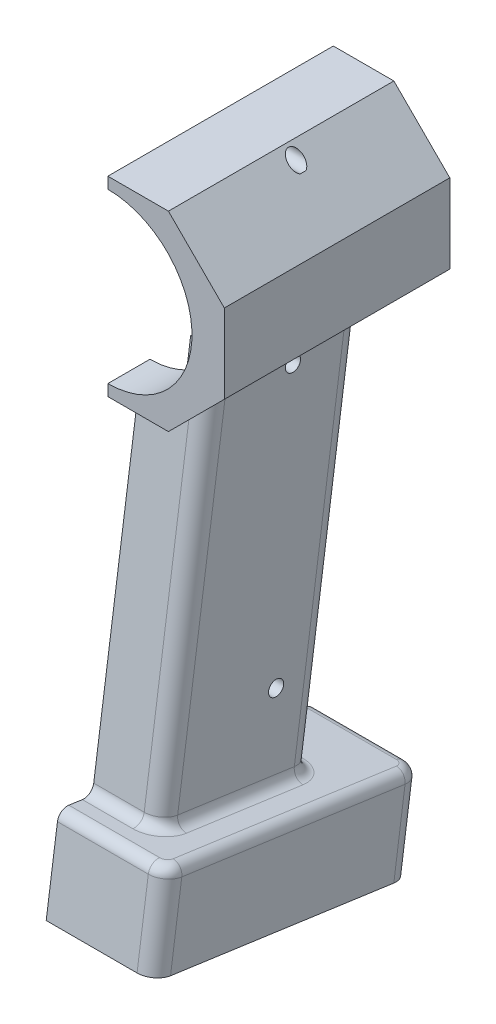
from build123d import *
from build123d.topology import SkipClean

# Parameters (mm, degrees)
Y_KSEKLIK_EKSTR_ZYON1_DEPTH      = 67
IZIM2_R                          = 25.000000000000004
KES_EKSTR_ZYON1_DEPTH            = 70
Y_KSEKLIK_EKSTR_ZYON2_DEPTH      = 40
Y_KSEKLIK_EKSTR_ZYON7_DEPTH      = 100
Y_KSEKLIK_EKSTR_ZYON7_DEPTH_BACK = 15
IZIM11_R                         = 22.5
KES_EKSTR_ZYON17_DEPTH           = 33
KES_EKSTR_ZYON18_DEPTH           = 20
Y_KSEKLIK_EKSTR_ZYON12_DEPTH     = 8
Y_KSEKLIK_EKSTR_ZYON14_DEPTH     = 15
KES_EKSTR_ZYON20_DEPTH           = 3
IZIM44_R                         = 22.600000000000005
KES_EKSTR_ZYON25_DEPTH           = 30
RADYUS4_R                        = 5
RADYUS5_START                    = -109.324597764
RADYUS5_DEPTH                    = 115
Y_KSEKLIK_EKSTR_ZYON27_DEPTH     = 27
Y_KSEKLIK_EKSTR_ZYON29_START     = 5
Y_KSEKLIK_EKSTR_ZYON29_DEPTH     = 5
RADYUS6_R                        = 3
RADYUS7_R                        = 5
IZIM53_R                         = 1.0999999999999992
IZIM53_R_2                       = 1.0999999999999983
KES_EKSTR_ZYON28_DEPTH           = 3
IZIM54_R                         = 4.249999999999999
IZIM54_R_2                       = 3.099999999999997
Y_KSEKLIK_EKSTR_ZYON33_DEPTH     = 22.5
Y_KSEKLIK_EKSTR_ZYON34_DEPTH     = 67
RADYUS9_R                        = 3
IZIM63_R                         = 0.8999999999999964
IZIM63_R_2                       = 0.8999999999999968
KES_EKSTR_ZYON30_DEPTH           = 6
RADYUS10_R                       = 3
KES_EKSTR_ZYON31_START           = -10
IZIM64_R                         = 3.099999999999997
KES_EKSTR_ZYON31_DEPTH           = 10
IZIM65_R                         = 2.2499999999999996
IZIM65_R_2                       = 2.249999999999999
KES_EKSTR_ZYON32_DEPTH           = 20
IZIM68_R                         = 3.099999999999997
Y_KSEKLIK_EKSTR_ZYON35_DEPTH     = 5
IZIM69_R                         = 1.1000000000000003
KES_EKSTR_ZYON35_DEPTH           = 3
IZIM70_R                         = 2.2500000000000027
KES_EKSTR_ZYON36_DEPTH           = 3
Y_KSEKLIK_EKSTR_ZYON36_START     = 15
IZIM71_R                         = 3.099999999999997
IZIM71_R_2                       = 2.2500000000000027
Y_KSEKLIK_EKSTR_ZYON36_DEPTH     = 15
IZIM72_R                         = 25.000000000000004
KES_EKSTR_ZYON37_DEPTH           = 30


with BuildPart() as part:
    # Çizim1 → Yükseklik-Ekstrüzyon1 (new body)
    with BuildSketch(Plane.XY):
        Polygon((0, 0), (-18, -2.2e-15), (-34.617009357884086, 16.617009357883635), (-34.617009357884086, 40.117009357883624), (-18.000000000000455, 56.73401871576772), (-4.545e-13, 56.73401871576772), align=None)
    extrude(amount=Y_KSEKLIK_EKSTR_ZYON1_DEPTH)

    # Çizim2 → Kes-Ekstrüzyon1 (cut)
    with BuildSketch(Plane.XY.offset(67)):
        with Locations((0, 28.367009357883862)):
            Circle(IZIM2_R)
    extrude(amount=-KES_EKSTR_ZYON1_DEPTH, mode=Mode.SUBTRACT)

    # Çizim5 → Yükseklik-Ekstrüzyon2 (add)
    with BuildSketch(Plane.XY.offset(37.00000000000001)):
        with BuildLine():
            Line((0, 50.96700935788387), (-4.2591e-13, 53.367009357883866))
            ThreePointArc((-4.2591e-13, 53.36700935788386), (-25, 28.367009357883667), (-3.412e-14, 3.3670093578838625))
            Line((-2.697e-14, 3.367009357883862), (0, 5.767009357883861))
            ThreePointArc((-4.15e-15, 5.767009357883861), (-22.6, 28.367009357883866), (1.38e-15, 50.96700935788387))
        make_face()
    extrude(amount=-Y_KSEKLIK_EKSTR_ZYON2_DEPTH)

    # Çizim24 → Kes-Ekstrüzyon18 (cut)
    with BuildSketch(Plane(origin=(0, -9.233851419869488, 1.2977331860663228), x_dir=(0, -0.13917310096006572, -0.9902680687415703), z_dir=(0, -0.9902680687415703, 0.13917310096006572))):
        Polygon((-54.45315730366845, 3.1e-16), (-42.45315730366844, 0), (-42.45315730366844, -17), (-54.45315730366845, -17), align=None)
    extrude(amount=-KES_EKSTR_ZYON18_DEPTH, mode=Mode.SUBTRACT)



with BuildPart() as body_2:
    # Çizim21 → Yükseklik-Ekstrüzyon7 (new, two sides: drawn at the far end of the back side and taken through both)
    with BuildSketch(Plane(origin=(0, -9.233851419869488, 1.2977331860663228), x_dir=(0, -0.13917310096006572, -0.9902680687415703), z_dir=(0, -0.9902680687415703, 0.13917310096006572)).offset(-Y_KSEKLIK_EKSTR_ZYON7_DEPTH_BACK)):
        Polygon((-56.95315730366845, 0), (-56.95315730366844, -20), (-11.95315730366845, -19.999999999999993), (-11.953157303668451, 8.27e-15), (-14.453157303668451, 7.96e-15), (-14.45315730366845, -17.499999999999996), (-54.45315730366845, -17.499999999999996), (-54.45315730366845, 3.1e-16), align=None)
    extrude(amount=Y_KSEKLIK_EKSTR_ZYON7_DEPTH + Y_KSEKLIK_EKSTR_ZYON7_DEPTH_BACK)

    # Çizim11 → Kes-Ekstrüzyon17 (cut)
    with BuildSketch(Plane.XY.offset(37.00000000000001)):
        with Locations((0, 28.367009357883862)):
            Circle(IZIM11_R)
    extrude(amount=-KES_EKSTR_ZYON17_DEPTH, mode=Mode.SUBTRACT)


with BuildPart() as part_1:
    add(part.part)

    add(body_2.part)  # Yükseklik-Ekstrüzyon12 merges body 2
    # Çizim29 → Yükseklik-Ekstrüzyon12 (add)
    with BuildSketch(Plane(origin=(0, -9.233851419869488, 1.2977331860663228), x_dir=(0, -0.13917310096006572, -0.9902680687415703), z_dir=(0, -0.9902680687415703, 0.13917310096006572))):
        Polygon((-42.45315730366844, 0), (-14.453157303668446, 0), (-14.453157303668442, -17.499999999999996), (-42.45315730366844, -17.499999999999996), align=None)
    extrude(amount=-Y_KSEKLIK_EKSTR_ZYON12_DEPTH)

    # Çizim31 → Yükseklik-Ekstrüzyon14 (add)
    with BuildSketch(Plane(origin=(0, -9.233851419869485, 1.2977331860663224), x_dir=(1, 0, 0), z_dir=(0, -0.9902680687415703, 0.13917310096006574))):
        Polygon((9.7e-16, 19.053157303668446), (2.4e-16, 17.053157303668446), (-4.9, 17.053157303668442), (-4.9, 14.45315730366844), (-17.499999999999996, 14.45315730366844), (-17.499999999999996, 19.053157303668446), align=None)
    extrude(amount=Y_KSEKLIK_EKSTR_ZYON14_DEPTH)

    # Çizim34 → Kes-Ekstrüzyon20 (cut)
    with BuildSketch(Plane(origin=(-1.1e-15, 1.663557968214996, 11.83682999846795), x_dir=(-1, -1e-17, -9e-17), z_dir=(0, -0.13917310096006574, -0.9902680687415703))):
        Polygon((-1.17e-15, -20.024597764324398), (3.0999999999999988, -20.024597764324398), (3.0999999999999983, -13.824597764324396), (-1.17e-15, -13.824597764324396), align=None)
    extrude(amount=-KES_EKSTR_ZYON20_DEPTH, mode=Mode.SUBTRACT)

    # Çizim44 → Kes-Ekstrüzyon25 (cut)
    with SkipClean():  # the faces are left unmerged after this step: merging them gives an invalid solid
        with BuildSketch(Plane.XY.offset(37.00000000000001)):
            with Locations((0, 28.367009357883862)):
                Circle(IZIM44_R)
        extrude(amount=-KES_EKSTR_ZYON25_DEPTH, mode=Mode.SUBTRACT)

    # Radyus4
    radyus4_edges = [part_1.edges().sort_by_distance(p)[0] for p in [
        (-19.999999999999993, -52.29855016290579, 19.420709717516388),
        (-20, -49.167155391304306, 64.42286164587061),
    ]]
    fillet(radyus4_edges, radius=RADYUS4_R)

    # Radyus5: read off the stored shape, not the designer's step
    # Radyus5 outline → Radyus5 (add)
    with SkipClean():  # the faces are left unmerged after this step: merging them gives an invalid solid
        with BuildSketch(Plane(origin=(0, 0, 0), x_dir=(1, 0, 0), z_dir=(0, 0.9902680687415703, -0.13917310096006602)).offset(RADYUS5_START)):
            with BuildLine():
                Line((-17.5, -52.453157304), (-17.5, -54.453157304))
                Line((-17.5, -54.453157304), (-15.5, -54.453157304))
                ThreePointArc((-15.5, -54.453157304), (-16.914213562, -53.867370866), (-17.5, -52.453157304))
            make_face()
            with BuildLine():
                Line((-17.5, -14.453157304), (-17.5, -16.453157304))
                ThreePointArc((-17.5, -16.453157304), (-16.914213562, -15.038943742), (-15.5, -14.453157304))
                Line((-15.5, -14.453157304), (-17.5, -14.453157304))
            make_face()
        extrude(amount=RADYUS5_DEPTH)



with BuildPart() as body_2_2:
    # Çizim45 → Yükseklik-Ekstrüzyon27 (new body)
    with BuildSketch(Plane(origin=(0, -108.26065829402661, 15.215043282072942), x_dir=(1, 0, 0), z_dir=(0, -0.9902680687415704, 0.13917310096006608))):
        Polygon((0, 67), (-32, 67), (-32, -10), (1.22e-15, -10), (0, -4.999999999999998), (-26.999999999999996, -4.999999999999998), (-27, 62), (6.1e-16, 62.00000000000001), align=None)
    extrude(amount=Y_KSEKLIK_EKSTR_ZYON27_DEPTH)


with BuildPart() as part_2:
    with SkipClean():  # the faces are left unmerged after this step: merging them gives an invalid solid
        add(part_1.part)

        add(body_2_2.part)  # Yükseklik-Ekstrüzyon29 merges body 2 2
        # Çizim58 → Yükseklik-Ekstrüzyon29 (add)
        with BuildSketch(Plane(origin=(0, -108.26065829402661, 15.215043282072942), x_dir=(1, 0, 0), z_dir=(0, -0.9902680687415704, 0.13917310096006608)).offset(Y_KSEKLIK_EKSTR_ZYON29_START)):
            with BuildLine():
                Line((-15.000000000000002, 56.95315730366841), (0, 56.95315730366841))
                Line((4.1e-16, 56.95315730366841), (6.1e-16, 62.00000000000003))
                Line((0, 62.00000000000003), (-27, 62.000000000000014))
                Line((-27, 62.000000000000014), (-26.999999999999996, -4.999999999999997))
                Line((-26.999999999999996, -4.999999999999997), (0, -4.999999999999997))
                Line((0, -4.999999999999998), (6.94e-15, 11.953157303668416))
                Line((8.88e-15, 11.953157303668416), (-14.999999999999993, 11.953157303668416))
                ThreePointArc((-14.999999999999993, 11.953157303668416), (-18.53553390593273, 13.417623397735682), (-19.999999999999993, 16.953157303668416))
                Line((-19.999999999999993, 16.953157303668412), (-20, 51.95315730366841))
                ThreePointArc((-20, 51.95315730366841), (-18.535533905932738, 55.48869120960115), (-15.000000000000002, 56.95315730366841))
            make_face()
            with BuildLine():
                ThreePointArc((-17.499999999999996, 52.453157303668426), (-16.91421356237308, 53.86737086604151), (-15.499999999999995, 54.45315730366841))
                Line((-15.499999999999995, 54.45315730366841), (0, 54.45315730366841))
                Line((3.1e-16, 54.45315730366841), (4.1e-16, 56.95315730366841))
                Line((0, 56.95315730366841), (-15.000000000000002, 56.95315730366841))
                ThreePointArc((-15.000000000000002, 56.95315730366841), (-18.535533905932738, 55.48869120960115), (-20, 51.95315730366841))
                Line((-20, 51.95315730366841), (-19.999999999999993, 16.953157303668412))
                ThreePointArc((-19.999999999999993, 16.953157303668416), (-18.53553390593273, 13.417623397735682), (-14.999999999999993, 11.953157303668416))
                Line((-14.999999999999993, 11.953157303668416), (8.88e-15, 11.953157303668416))
                Line((6.94e-15, 11.953157303668416), (7.96e-15, 14.453157303668414))
                Line((7.96e-15, 14.453157303668414), (-15.499999999999996, 14.453157303668437))
                ThreePointArc((-15.499999999999996, 14.453157303668439), (-16.914213562373092, 15.038943741295348), (-17.5, 16.453157303668444))
                Line((-17.499999999999996, 16.453157303668444), (-17.499999999999996, 19.05315730366844))
                Line((-17.499999999999996, 19.05315730366844), (-17.499999999999996, 52.45315730366843))
            make_face()
        extrude(amount=-Y_KSEKLIK_EKSTR_ZYON29_DEPTH)

    # Radyus6
    radyus6_edges = [part_2.edges().sort_by_distance(p)[0] for p in [
        (-19.999999999999996, -103.46570555421005, 49.33290482722616),
        (-7.499999999999993, -106.59710032581151, 27.051873280540846),
        (-18.535533905932738, -100.53812507017076, 70.163722363202),
        (-18.53553390593273, -106.39328603824929, 28.502087291250334),
        (-7.500000000000001, -100.33431078260855, 71.6139363739115),
        (-16, -98.93606052970219, 81.56300388775816),
        (-32, -104.29422491666473, 43.4376832412077),
        (-16, -109.65238930362727, 5.312362594657239),
    ]]
    fillet(radyus6_edges, radius=RADYUS6_R)

    # Radyus7
    # the kernel refuses this fillet: 5 mm, written as the material it takes off along each edge
    with BuildSketch(Plane(origin=(-27, -99.63192603450251, 76.61166354405032), x_dir=(-1.0000000000000002, 0, 0), z_dir=(0, -0.1391731009600661, -0.9902680687415706))) as radyus7_piece_1:
        with BuildLine():
            CenterArc((2, -3), 3, 0, 90)
            Line((5, -3), (5, 0))
            Line((5, 0), (2, 0))
        make_face()
    revolve(axis=Axis((-27, -99.63192603450251, 76.61166354405032), (0, 0.9902680687415704, -0.13917310096006608)), revolution_arc=90, mode=Mode.SUBTRACT)
    with BuildSketch(Plane(origin=(-27, -108.95652379882695, 10.263702938365089), x_dir=(0, -0.13917310096006605, -0.9902680687415703), z_dir=(1.0000000000000002, 0, 0))) as radyus7_piece_2:
        with BuildLine():
            CenterArc((2, -3), 3, 0, 90)
            Line((5, -3), (5, 0))
            Line((5, 0), (2, 0))
        make_face()
    revolve(axis=Axis((-27, -108.95652379882695, 10.263702938365089), (0, 0.9902680687415704, -0.13917310096006608)), revolution_arc=90, mode=Mode.SUBTRACT)
    with BuildSketch(Plane(origin=(-32, -98.9360605297022, 81.56300388775816), x_dir=(1, 3.9e-16, 2.79e-15), z_dir=(0, -0.9902680687415703, 0.13917310096006605))) as radyus7_piece_3:
        with BuildLine():
            CenterArc((RADYUS7_R, -RADYUS7_R), RADYUS7_R, 89.99999999999983, 90.00000000000014)
            Line((-1.407e-14, -RADYUS7_R), (0, 0))
            Line((0, 0), (RADYUS7_R, 0))
        make_face()
    extrude(amount=39.49999999999999, mode=Mode.SUBTRACT)
    with BuildSketch(Plane(origin=(-32, -109.65238930362727, 5.31236259465724), x_dir=(1, -1e-17, -4e-17), z_dir=(0, -0.9902680687415703, 0.13917310096006605))) as radyus7_piece_4:
        with BuildLine():
            CenterArc((RADYUS7_R, RADYUS7_R), RADYUS7_R, 180.00000000000006, 89.99999999999994)
            Line((-2.2e-16, RADYUS7_R), (0, 0))
            Line((0, 0), (RADYUS7_R, 0))
        make_face()
    extrude(amount=39.500000000000014, mode=Mode.SUBTRACT)

    # Çizim53 → Kes-Ekstrüzyon28 (cut)
    with BuildSketch(Plane(origin=(0, 0, 0), x_dir=(0, 0, -1), z_dir=(1, 8.07e-15, 0))):
        with Locations(Location((-32, 1, 0), (0, 0, 90))):
            Circle(IZIM53_R)
        with Locations(Location((-32.00000000000001, 53.8, 0), (0, 0, 90))):
            Circle(IZIM53_R_2)
    extrude(amount=-KES_EKSTR_ZYON28_DEPTH, mode=Mode.SUBTRACT)

    # Çizim54 → Yükseklik-Ekstrüzyon33 (add)
    with BuildSketch(Plane(origin=(-17.499999999999996, 0, 0), x_dir=(0, 0, -1), z_dir=(1, 0, 0))):
        with Locations(Location((-36.999999999999986, -80, 0), (0, 0, 180))):
            Circle(IZIM54_R)
        with Locations(Location((-36.999999999999986, -80, 0), (0, 0, 180))):
            Circle(IZIM54_R_2, mode=Mode.SUBTRACT)
    extrude(amount=Y_KSEKLIK_EKSTR_ZYON33_DEPTH)

    # Çizim62 → Yükseklik-Ekstrüzyon34 (add)
    with BuildSketch(Plane(origin=(-3.156e-14, 8.628732259524103, 61.39662026197741), x_dir=(-1, -7e-17, -5e-16), z_dir=(0, -0.13917310096006608, -0.9902680687415704))):
        with BuildLine():
            Line((27.000000000000004, -117.92459776432452), (26.500000000000004, -117.92459776432452))
            ThreePointArc((26.500000000000004, -117.92459776432452), (25.750000000000004, -117.17459776432452), (26.500000000000004, -116.42459776432452))
            Line((26.500000000000004, -116.42459776432452), (27.000000000000004, -116.42459776432452))
            Line((27.000000000000004, -116.42459776432452), (27.000000000000004, -117.92459776432452))
        make_face()
    extrude(amount=Y_KSEKLIK_EKSTR_ZYON34_DEPTH)

    # Radyus9
    radyus9_edges = [part_2.edges().sort_by_distance(p)[0] for p in [
        (-13.499999999999998, -113.90786414253479, 10.959568443165423),
        (-13.5, -104.58326637821037, 77.30752904885065),
    ]]
    fillet(radyus9_edges, radius=RADYUS9_R)

    # Çizim63 → Kes-Ekstrüzyon30 (cut)
    with BuildSketch(Plane(origin=(-9.75e-15, -134.99789615004912, 18.97271700799474), x_dir=(1, -7e-17, 1e-17), z_dir=(0, -0.9902680687415704, 0.13917310096006608))):
        with Locations(Location((-28.697056274847743, 63.69705627484778, 0), (0, 0, 270))):
            Circle(IZIM63_R)
        with Locations(Location((-28.697056274847743, -6.697056274847762, 0), (0, 0, 90))):
            Circle(IZIM63_R_2)
    extrude(amount=-KES_EKSTR_ZYON30_DEPTH, mode=Mode.SUBTRACT)

    # Radyus10
    radyus10_edges = [part_2.edges().sort_by_distance(p)[0] for p in [
        (-7.749999999999994, -111.20050791711931, 30.223408957195126),
        (-16.914213562373092, -111.11898220209441, 30.803494561478942),
        (-17.5, -108.41704589791797, 50.02877033202655),
        (-16.914213562373085, -105.71510959374154, 69.25404610257414),
        (-7.749999999999997, -105.63358387871666, 69.83413170685793),
    ]]
    fillet(radyus10_edges, radius=RADYUS10_R)

    # Çizim64 → Kes-Ekstrüzyon31 (cut)
    with BuildSketch(Plane(origin=(-17.499999999999996, 0, 0), x_dir=(0, 0, -1), z_dir=(1, 0, 0)).offset(KES_EKSTR_ZYON31_START)):
        with Locations(Location((-36.999999999999986, -80, 0), (0, 0, 180))):
            Circle(IZIM64_R)
    extrude(amount=KES_EKSTR_ZYON31_DEPTH, mode=Mode.SUBTRACT)

    # Çizim65 → Kes-Ekstrüzyon32 (cut)
    with BuildSketch(Plane(origin=(-3, -2.422e-14, 0), x_dir=(0, 0, -1), z_dir=(1, 8.07e-15, 0))):
        with Locations(Location((-32.00000000000001, 53.8, 0), (0, 0, 90))):
            Circle(IZIM65_R)
        with Locations(Location((-32, 1, 0), (0, 0, 90))):
            Circle(IZIM65_R_2)
    extrude(amount=-KES_EKSTR_ZYON32_DEPTH, mode=Mode.SUBTRACT)

    # Çizim68 → Yükseklik-Ekstrüzyon35 (add)
    with BuildSketch(Plane(origin=(-4.999999999999996, 0, 0), x_dir=(0, 0, -1), z_dir=(1, 0, 0))):
        with Locations(Location((-36.999999999999986, -80, 0), (0, 0, 180))):
            Circle(IZIM68_R)
    extrude(amount=Y_KSEKLIK_EKSTR_ZYON35_DEPTH)

    # Çizim69 → Kes-Ekstrüzyon35 (cut)
    with BuildSketch(Plane(origin=(0, 0, 0), x_dir=(0, 0, -1), z_dir=(1, 0, 0))):
        with Locations((-36.999999999999986, -80)):
            Circle(IZIM69_R)
    extrude(amount=-KES_EKSTR_ZYON35_DEPTH, mode=Mode.SUBTRACT)

    # Çizim70 → Kes-Ekstrüzyon36 (cut)
    with BuildSketch(Plane(origin=(-3, 0, 0), x_dir=(0, 0, -1), z_dir=(1, 0, 0))):
        with Locations((-36.999999999999986, -80)):
            Circle(IZIM70_R)
    extrude(amount=-KES_EKSTR_ZYON36_DEPTH, mode=Mode.SUBTRACT)

    # Çizim71 → Yükseklik-Ekstrüzyon36 (add)
    with BuildSketch(Plane.ZY.offset(4.999999999999996).offset(Y_KSEKLIK_EKSTR_ZYON36_START)):
        with Locations((36.999999999999986, -80)):
            Circle(IZIM71_R)
        with Locations(Location((36.999999999999986, -80, 0), (0, 0, 180))):
            Circle(IZIM71_R_2, mode=Mode.SUBTRACT)
    extrude(amount=-Y_KSEKLIK_EKSTR_ZYON36_DEPTH)

    # Çizim72 → Kes-Ekstrüzyon37 (cut)
    with BuildSketch(Plane.XY.offset(67)):
        with Locations((0, 28.367009357883862)):
            Circle(IZIM72_R)
    extrude(amount=-KES_EKSTR_ZYON37_DEPTH, mode=Mode.SUBTRACT)


with BuildPart() as body_2_3:
    # Aynalama6: mirrored copy
    add(part_2.part.mirror(Plane(origin=(40, 0, 0), x_dir=(0, 0, 1), z_dir=(1, 0, 0))))


solid = body_2_3.part
